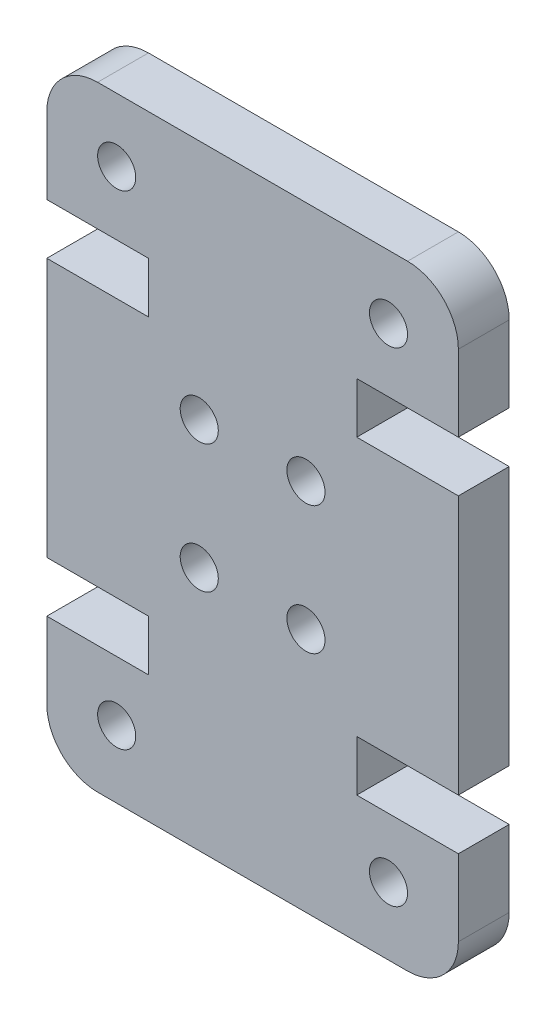
from build123d import *

# Parameters (mm, degrees)
SKETCH1_R           = 0.75
BOSS_EXTRUDE1_DEPTH = 2


with BuildPart() as part:
    # Sketch1 → Boss-Extrude1 (new body)
    with BuildSketch(Plane.XY):
        with BuildLine():
            Line((2, 24.2), (14.2, 24.2))
            ThreePointArc((14.2, 24.2), (15.614213562, 23.614213562), (16.2, 22.2))
            Line((16.2, 22.2), (16.2, 19.2))
            Line((16.2, 19.2), (12.2, 19.2))
            Line((12.2, 19.2), (12.2, 17.2))
            Line((12.2, 17.2), (16.2, 17.2))
            Line((16.2, 17.2), (16.2, 7))
            Line((16.2, 7), (12.2, 7))
            Line((12.2, 7), (12.2, 5))
            Line((12.2, 5), (16.2, 5))
            Line((16.2, 5), (16.2, 2))
            ThreePointArc((16.2, 2), (15.614213562, 0.585786438), (14.2, 0))
            Line((14.2, 0), (2, 0))
            ThreePointArc((2, 0), (0.585786438, 0.585786438), (0, 2))
            Line((0, 2), (0, 5))
            Line((0, 5), (4, 5))
            Line((4, 5), (4, 7))
            Line((4, 7), (0, 7))
            Line((0, 7), (0, 17.2))
            Line((0, 17.2), (4, 17.2))
            Line((4, 17.2), (4, 19.2))
            Line((4, 19.2), (0, 19.2))
            Line((0, 19.2), (0, 22.2))
            ThreePointArc((0, 22.2), (0.585786438, 23.614213562), (2, 24.2))
        make_face()
        with Locations((10.2, 14.7)):
            Circle(SKETCH1_R, mode=Mode.SUBTRACT)
        with Locations((6, 14.7)):
            Circle(SKETCH1_R, mode=Mode.SUBTRACT)
        with Locations((10.2, 9.653551169)):
            Circle(SKETCH1_R, mode=Mode.SUBTRACT)
        with Locations((6, 9.653551169)):
            Circle(SKETCH1_R, mode=Mode.SUBTRACT)
        with Locations((13.45, 2.653551169)):
            Circle(SKETCH1_R, mode=Mode.SUBTRACT)
        with Locations((2.75, 2.653551169)):
            Circle(SKETCH1_R, mode=Mode.SUBTRACT)
        with Locations((13.45, 21.7)):
            Circle(SKETCH1_R, mode=Mode.SUBTRACT)
        with Locations((2.75, 21.7)):
            Circle(SKETCH1_R, mode=Mode.SUBTRACT)
    extrude(amount=BOSS_EXTRUDE1_DEPTH)


solid = part.part
